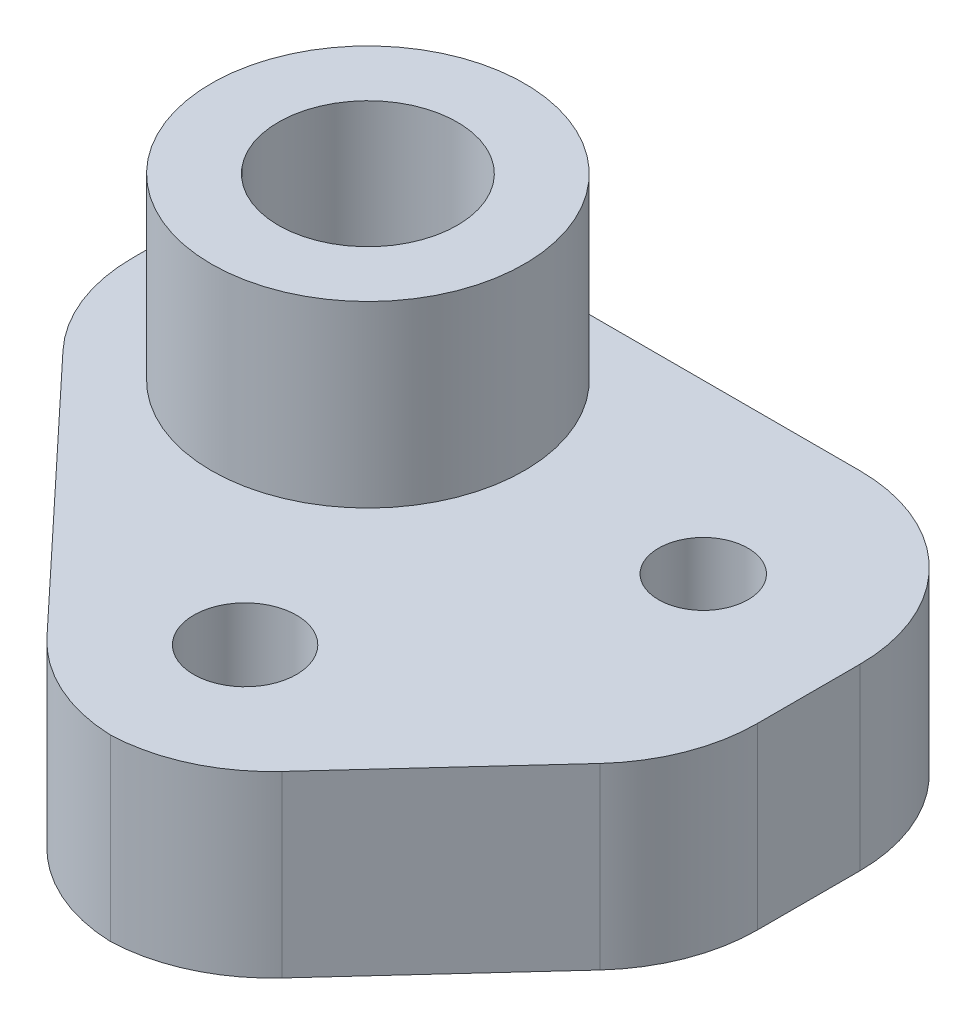
from build123d import *

# Parameters (mm, degrees)
BOSS_EXTRU_1_DEPTH      = 8
CONG_1_R                = 7.5
ENL_V_MAT_EXTRU_1_REACH = 32.467
ESQUISSE2_R             = 2
ESQUISSE2_R_2           = 2.3
ESQUISSE3_R             = 7
ESQUISSE3_R_2           = 4
BOSS_EXTRU_2_DEPTH      = 8
CONG_2_R                = 7.5


with BuildPart() as part:
    # Esquisse1 → Boss.-Extru.1 (new body)
    with BuildSketch(Plane(origin=(0, 0, 0), x_dir=(1, 0, 0), z_dir=(0, 1, 0))):
        Polygon((-10, -3.5), (5, -19.5), (11, -19.5), (22, -7.5), (22, 7.5), (-10, 7.5), align=None)
    extrude(amount=BOSS_EXTRU_1_DEPTH)

    # Congé1
    cong_1_edges = [part.edges().sort_by_distance(p)[0] for p in [
        (-10, 4, -7.5),
        (22, 4, -7.5),
    ]]
    fillet(cong_1_edges, radius=CONG_1_R)

    # Esquisse2 → Enlèv. mat.-Extru.1 (cut, up to next)
    with BuildSketch(Plane(origin=(0, 8, 0), x_dir=(1, 0, 0), z_dir=(0, 1, 0)), mode=Mode.PRIVATE) as enl_v_mat_extru_1_sk1:
        with Locations(Location((15, 0, 0), (0, 0, 270))):
            Circle(ESQUISSE2_R)
    enl_v_mat_extru_1_tool1 = extrude(enl_v_mat_extru_1_sk1.sketch, amount=-ENL_V_MAT_EXTRU_1_REACH, mode=Mode.PRIVATE) & part.part
    # Esquisse2 → Enlèv. mat.-Extru.1 (cut, up to next)
    with BuildSketch(Plane(origin=(0, 8, 0), x_dir=(1, 0, 0), z_dir=(0, 1, 0)), mode=Mode.PRIVATE) as enl_v_mat_extru_1_sk2:
        with Locations(Location((7.5, -12.990381057, 0), (0, 0, 270))):
            Circle(ESQUISSE2_R_2)
    enl_v_mat_extru_1_tool2 = extrude(enl_v_mat_extru_1_sk2.sketch, amount=-ENL_V_MAT_EXTRU_1_REACH, mode=Mode.PRIVATE) & part.part
    add(enl_v_mat_extru_1_tool1.solids().sort_by_distance((15, 8, 0))[0], mode=Mode.SUBTRACT)
    add(enl_v_mat_extru_1_tool2.solids().sort_by_distance((7.5, 8, 12.990381))[0], mode=Mode.SUBTRACT)

    # Esquisse3 → Boss.-Extru.2 (add)
    with BuildSketch(Plane(origin=(0, 8, 0), x_dir=(1, 0, 0), z_dir=(0, 1, 0))):
        with Locations(Location((0, 0, 0), (0, 0, 270))):
            Circle(ESQUISSE3_R)
        with Locations(Location((0, 0, 0), (0, 0, 270))):
            Circle(ESQUISSE3_R_2, mode=Mode.SUBTRACT)
    extrude(amount=BOSS_EXTRU_2_DEPTH)

    # Congé2
    # the kernel refuses this fillet: 7.5 mm, written as the material it takes off along each edge
    with BuildSketch(Plane(origin=(22, -7.293444198, 7.5), x_dir=(-0.6757246285173467, 0, 0.7371541402007411), z_dir=(0, 1, 0))) as cong_2_piece_1:
        with BuildLine():
            CenterArc((CONG_2_R * 0.388983690555, -CONG_2_R), CONG_2_R, 90, 42.510447078)
            Line((-CONG_2_R * 0.286740937963, -CONG_2_R * 0.262845859799), (0, 0))
            Line((0, 0), (CONG_2_R * 0.388983690555, 0))
        make_face()
    extrude(amount=22.586888396, mode=Mode.SUBTRACT)
    with BuildSketch(Plane(origin=(11, -8.248157181, 19.5), x_dir=(-1, 0, 0), z_dir=(0, 1, 0))) as cong_2_piece_2:
        with BuildLine():
            CenterArc((CONG_2_R * 0.439901716342, -CONG_2_R), CONG_2_R, 90, 47.489552922)
            Line((-CONG_2_R * 0.297252423859, -CONG_2_R * 0.324275371483), (0, 0))
            Line((0, 0), (CONG_2_R * 0.439901716342, 0))
        make_face()
    extrude(amount=24.496314363, mode=Mode.SUBTRACT)
    with BuildSketch(Plane(origin=(5, -8.123100234, 19.5), x_dir=(-0.6839411288813303, 0, -0.7295372041400847), z_dir=(0, 1, 0))) as cong_2_piece_3:
        with BuildLine():
            CenterArc((CONG_2_R * 0.433232012466, -CONG_2_R), CONG_2_R, 90, 46.847610266)
            Line((-CONG_2_R * 0.296305191674, -CONG_2_R * 0.316058871119), (0, 0))
            Line((0, 0), (CONG_2_R * 0.433232012466, 0))
        make_face()
    extrude(amount=24.246200467, mode=Mode.SUBTRACT)
    with BuildSketch(Plane(origin=(-10, -7.414640249, 3.5), x_dir=(0, 0, -1), z_dir=(0, 1, 0))) as cong_2_piece_4:
        with BuildLine():
            CenterArc((CONG_2_R * 0.395447479964, -CONG_2_R), CONG_2_R, 90, 43.152389734)
            Line((-CONG_2_R * 0.288493648917, -CONG_2_R * 0.27046279586), (0, 0))
            Line((0, 0), (CONG_2_R * 0.395447479964, 0))
        make_face()
    extrude(amount=22.829280499, mode=Mode.SUBTRACT)


solid = part.part
